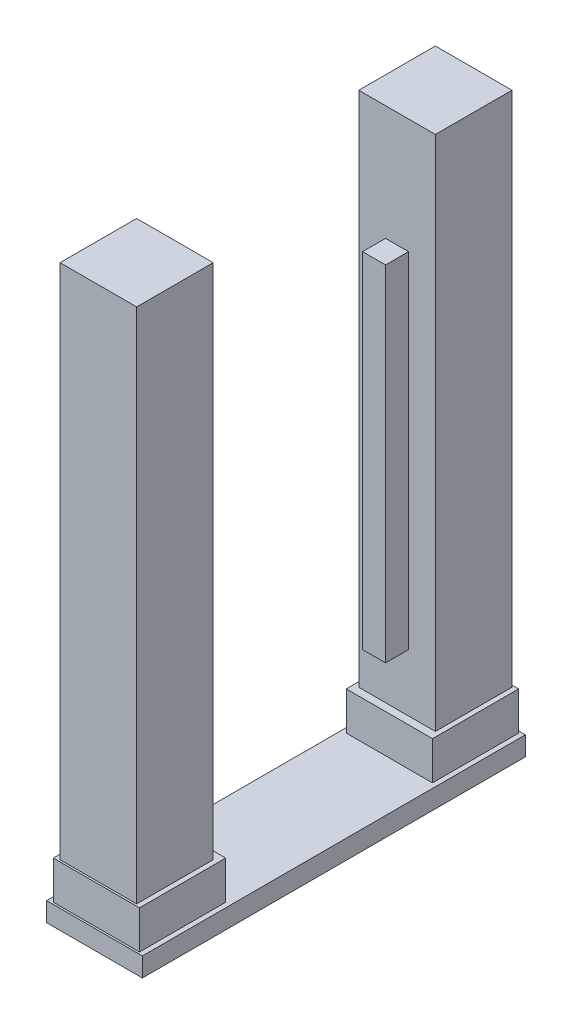
from build123d import *

# Parameters (mm, degrees)
SKETCH1_W               = 50
SKETCH1_H               = 200
BOSS_EXTRUDE1_DEPTH     = 10
SKETCH2_W               = 45
SKETCH2_H               = 45
BOSS_EXTRUDE2_DEPTH     = 20
BOSS_EXTRUDE2_2_DEPTH   = 20
SKETCH3_W               = 40
SKETCH3_H               = 40
BOSS_EXTRUDE3_DEPTH     = 270
BOSS_EXTRUDE3_2_DEPTH   = 270
BOSS_EXTRUDE4_START     = -240
BOSS_EXTRUDE4_OUTLINE_W = 12
BOSS_EXTRUDE4_OUTLINE_H = 12
BOSS_EXTRUDE4_DEPTH     = 180


# Read off the part's stored shape, not the designer's step: Boss-Extrude4
with BuildPart() as part:
    # Sketch1 → Boss-Extrude1 (new body)
    with BuildSketch(Plane(origin=(0, 0, 0), x_dir=(1, 0, 0), z_dir=(0, 1, 0))):
        Rectangle(SKETCH1_W, SKETCH1_H)
    extrude(amount=BOSS_EXTRUDE1_DEPTH)


with BuildPart() as body_2:
    # Sketch2 → Boss-Extrude2 (new body)
    with BuildSketch(Plane(origin=(0, 10, 0), x_dir=(1, 0, 0), z_dir=(0, 1, 0))):
        with Locations((0, 76.5)):
            Rectangle(SKETCH2_W, SKETCH2_H)
    extrude(amount=BOSS_EXTRUDE2_DEPTH)


with BuildPart() as body_3:
    # Sketch2 → Boss-Extrude2 2 (new body)
    with BuildSketch(Plane(origin=(0, 10, 0), x_dir=(1, 0, 0), z_dir=(0, 1, 0))):
        with Locations((0, -76.5)):
            Rectangle(SKETCH2_W, SKETCH2_H)
    extrude(amount=BOSS_EXTRUDE2_2_DEPTH)


with BuildPart() as body_4:
    # Sketch3 → Boss-Extrude3 (new body)
    with BuildSketch(Plane(origin=(0, 30, 0), x_dir=(1, 0, 0), z_dir=(0, 1, 0))):
        with Locations((0, 78)):
            Rectangle(SKETCH3_W, SKETCH3_H)
    extrude(amount=BOSS_EXTRUDE3_DEPTH)


with BuildPart() as body_5:
    # Sketch3 → Boss-Extrude3 2 (new body)
    with BuildSketch(Plane(origin=(0, 30, 0), x_dir=(1, 0, 0), z_dir=(0, 1, 0))):
        with Locations((0, -78)):
            Rectangle(SKETCH3_W, SKETCH3_H)
    extrude(amount=BOSS_EXTRUDE3_2_DEPTH)


with BuildPart() as body_6:
    # Boss-Extrude4 outline → Boss-Extrude4 (new body)
    with BuildSketch(Plane(origin=(0, 300, 0), x_dir=(1, 0, 0), z_dir=(0, 1, 0)).offset(BOSS_EXTRUDE4_START)):
        with Locations((0, -52)):
            Rectangle(BOSS_EXTRUDE4_OUTLINE_W, BOSS_EXTRUDE4_OUTLINE_H)
        with Locations((0, 52)):
            Rectangle(BOSS_EXTRUDE4_OUTLINE_W, BOSS_EXTRUDE4_OUTLINE_H)
    extrude(amount=BOSS_EXTRUDE4_DEPTH)


solid = Compound([part.part, body_2.part, body_3.part, body_4.part, body_5.part, body_6.part])
